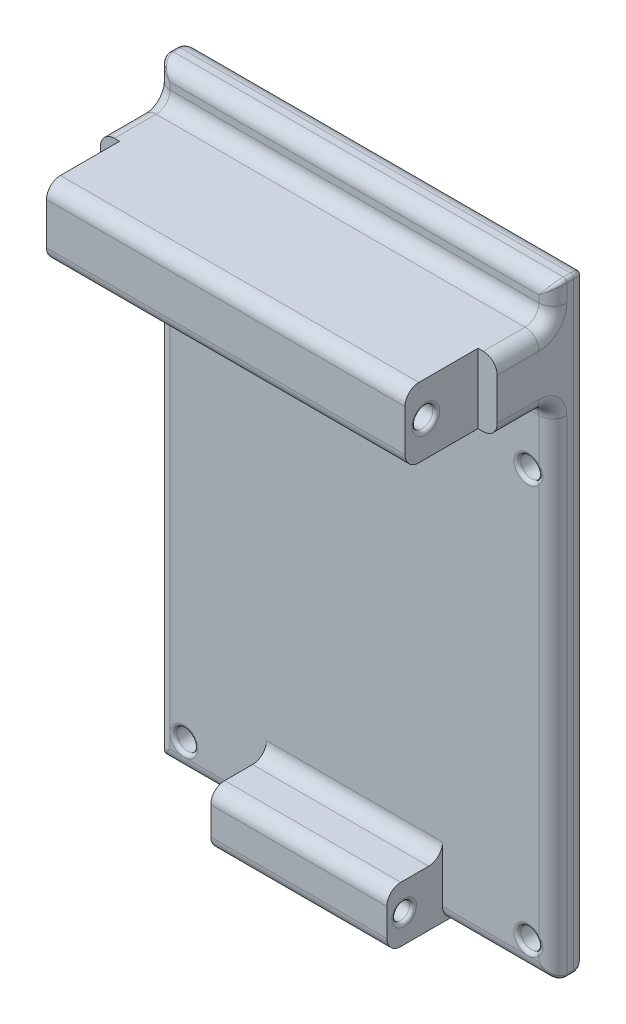
from build123d import *

# Parameters (mm, degrees)
ESQUISSE1_W             = 57
ESQUISSE1_H             = 87
ESQUISSE1_R             = 1.5
BOSS_EXTRU_1_DEPTH      = 5
ESQUISSE2_W             = 25.3
ESQUISSE2_H             = 8
BOSS_EXTRU_2_DEPTH      = 8
ESQUISSE3_R             = 1.25
ENL_V_MAT_EXTRU_1_DEPTH = 98.114996267
ESQUISSE4_W             = 57
ESQUISSE4_H             = 10
BOSS_EXTRU_3_DEPTH      = 8
ESQUISSE5_W             = 51.5
ESQUISSE5_H             = 10
BOSS_EXTRU_4_DEPTH      = 10.5
ESQUISSE6_R             = 1.5
ENL_V_MAT_EXTRU_2_DEPTH = 106.187035798
CONG_1_R                = 2
CONG_2_R                = 0.5


with BuildPart() as part:
    # Esquisse1 → Boss.-Extru.1 (new body)
    with BuildSketch(Plane.XY):
        with Locations((28.5, 43.5)):
            Rectangle(ESQUISSE1_W, ESQUISSE1_H)
        with Locations((4, 4)):
            Circle(ESQUISSE1_R, mode=Mode.SUBTRACT)
        with Locations((53.4, 4)):
            Circle(ESQUISSE1_R, mode=Mode.SUBTRACT)
        with Locations((53.4, 62.6)):
            Circle(ESQUISSE1_R, mode=Mode.SUBTRACT)
        with Locations((4, 62.6)):
            Circle(ESQUISSE1_R, mode=Mode.SUBTRACT)
    extrude(amount=BOSS_EXTRU_1_DEPTH)

    # Esquisse2 → Boss.-Extru.2 (add)
    with BuildSketch(Plane.XY.offset(5)):
        with Locations((28.5, 4)):
            Rectangle(ESQUISSE2_W, ESQUISSE2_H)
    extrude(amount=BOSS_EXTRU_2_DEPTH)

    # Esquisse3 → Enlèv. mat.-Extru.1 (cut, through all)
    with BuildSketch(Plane.ZY.offset(-15.85)):
        with Locations((10.5, 4)):
            Circle(ESQUISSE3_R)
    extrude(amount=-ENL_V_MAT_EXTRU_1_DEPTH, mode=Mode.SUBTRACT)

    # Esquisse4 → Boss.-Extru.3 (add)
    with BuildSketch(Plane.XY.offset(5)):
        with Locations((28.5, 77)):
            Rectangle(ESQUISSE4_W, ESQUISSE4_H)
    extrude(amount=BOSS_EXTRU_3_DEPTH)

    # Esquisse5 → Boss.-Extru.4 (add)
    with BuildSketch(Plane.XY.offset(13)):
        with Locations((28.5, 77)):
            Rectangle(ESQUISSE5_W, ESQUISSE5_H)
    extrude(amount=BOSS_EXTRU_4_DEPTH)

    # Esquisse6 → Enlèv. mat.-Extru.2 (cut, through all)
    with BuildSketch(Plane.ZY.offset(-2.75)):
        with Locations((20.5, 77)):
            Circle(ESQUISSE6_R)
    extrude(amount=-ENL_V_MAT_EXTRU_2_DEPTH, mode=Mode.SUBTRACT)

    # Congé1
    cong_1_edges = [part.edges().sort_by_distance(p)[0] for p in [
        (57, 36, 5),
        (28.5, 87, 5),
        (49.075, 0, 5),
        (28.5, 8, 5),
        (28.5, 0, 13),
        (28.5, 8, 13),
        (0, 84.5, 5),
        (28.5, 87, 0),
        (57, 43.5, 0),
        (28.5, 0, 0),
        (57, 84.5, 5),
        (0, 36, 5),
        (0, 43.5, 0),
        (0, 82, 9),
        (28.5, 72, 5),
        (0, 72, 9),
        (57, 72, 9),
        (28.5, 82, 5),
        (57, 82, 9),
        (7.925, 0, 5),
        (28.5, 72, 23.5),
        (28.5, 82, 23.5),
    ]]
    fillet(cong_1_edges, radius=CONG_1_R)

    # Congé2
    cong_2_edges = [part.edges().sort_by_distance(p)[0] for p in [
        (51.9, 4, 0),
        (51.9, 4, 5),
        (2.5, 4, 0),
        (2.5, 4, 5),
        (0.585786438, 86.414213562, 4.414213562),
        (56.414213318, 86.414213318, 4.414213806),
        (56.414213562, 0.585786438, 4.414213562),
        (0.585786438, 0.585786438, 4.414213562),
        (0.585786438, 0.585786438, 0.585786438),
        (0.585786438, 86.414213562, 0.585786438),
        (56.414213562, 0.585786438, 0.585786438),
        (56.414213562, 86.414213562, 0.585786438),
        (51.9, 62.6, 0),
        (51.9, 62.6, 5),
        (2.5, 62.6, 0),
        (2.5, 62.6, 5),
        (41.15, 4, 9.25),
        (15.85, 4, 9.25),
        (54.25, 77, 19),
        (2.75, 77, 19),
        (57, 87, 2.5),
        (57, 0, 2.5),
        (0, 0, 2.5),
        (0, 87, 2.5),
    ]]
    fillet(cong_2_edges, radius=CONG_2_R - 0.0001)  # a hair under: the kernel refuses the full size


solid = part.part
